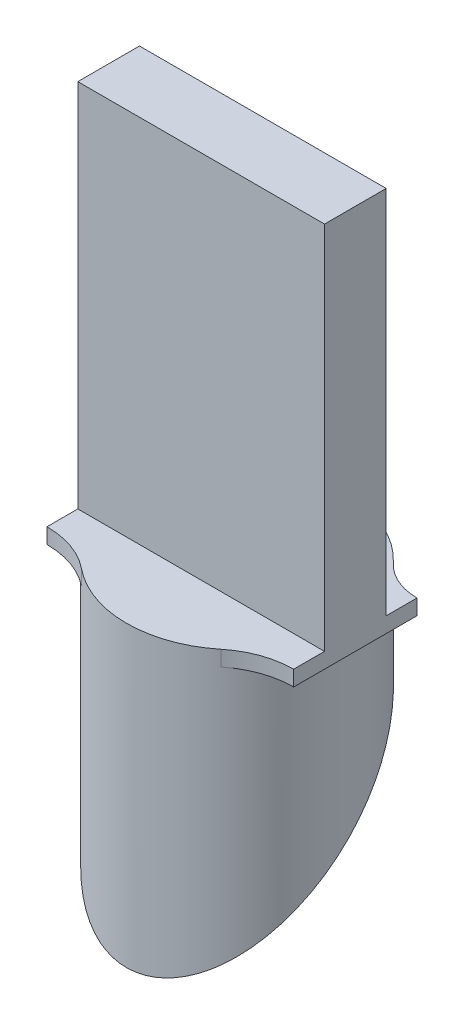
from build123d import *

# Parameters (mm, degrees)
CUT_EXTRUDE1_DEPTH      = 1054.2364613417774
CUT_EXTRUDE1_DEPTH_BACK = 1054.2364613417774
SHELL1_OUTLINE_W        = 19.594743879
SHELL1_OUTLINE_H        = 51.88948775799986
BOSS_EXTRUDE1_DEPTH     = 3.175
SKETCH5_W               = 50.79999999999999
SKETCH5_H               = 12.699999999999998
BOSS_EXTRUDE2_DEPTH     = 76.2


# Read off the part's stored shape, not the designer's step: Shell1
with BuildPart() as part:
    # Sketch2 → Revolve1 (revolve)
    with BuildSketch(Plane(origin=(0, 0, 0), x_dir=(0, 0, -1), z_dir=(1, 0, 0))):
        Polygon((1.0414000000000794, 1052.7210512242139), (-21.7283438789312, 1052.7210512242139), (-21.7283438789312, 994.4815634663521), (1.0414000000000847, 994.4815634663521), align=None)
    revolve(axis=Axis((0, 1052.7210512242139, -1.0414000000000794), (0, -1, -9e-17)))

    # Sketch3 → Cut-Extrude1 (cut, two sides: drawn at the far end of the back side and taken through both)
    with BuildSketch(Plane(origin=(0, 0, 0), x_dir=(0, 0, -1), z_dir=(1, 0, 0)).offset(-CUT_EXTRUDE1_DEPTH_BACK)):
        Polygon((-21.7283438789312, 994.4815634663521), (23.811143878931354, 1040.0210512242138), (23.811143878931365, 994.4815634663521), align=None)
    extrude(amount=CUT_EXTRUDE1_DEPTH + CUT_EXTRUDE1_DEPTH_BACK, mode=Mode.SUBTRACT)

    # Shell1 outline → Shell1 (revolve, cut)
    with BuildSketch(Plane.XY.offset(-1.0414)):
        with Locations((9.7973719395, 1023.601307345)):
            Rectangle(SHELL1_OUTLINE_W, SHELL1_OUTLINE_H)
    revolve(axis=Axis((0, 0, -1.0414), (0, 1, 0)), mode=Mode.SUBTRACT)

    # Sketch4 → Boss-Extrude1 (add)
    with BuildSketch(Plane(origin=(0, 1052.7210512242139, 9.407e-14), x_dir=(1, 0, 0), z_dir=(0, 1, 0))):
        with BuildLine():
            Line((25.4, 12.700000000000092), (25.4, -12.699999999999907))
            ThreePointArc((25.4, -12.699999999999907), (19.547591344304465, -13.709181649641387), (14.371169963720073, -16.62016024211882))
            ThreePointArc((14.371169963720073, -16.62016024211882), (-8.72e-15, -21.72834387893111), (-14.371169963720085, -16.620160242118818))
            ThreePointArc((-14.371169963720085, -16.620160242118818), (-19.54759134430447, -13.709181649641383), (-25.4, -12.699999999999907))
            Line((-25.4, -12.699999999999907), (-25.4, 12.700000000000092))
            ThreePointArc((-25.4, 12.700000000000092), (-20.663631299775105, 13.690635523953107), (-16.72131200571086, 16.496462637200914))
            ThreePointArc((-16.72131200571086, 16.496462637200914), (1.39e-15, 23.811143878931446), (16.72131200571086, 16.496462637200906))
            ThreePointArc((16.72131200571086, 16.496462637200906), (20.663631299775105, 13.690635523953098), (25.4, 12.700000000000092))
        make_face()
    extrude(amount=BOSS_EXTRUDE1_DEPTH)

    # Sketch5 → Boss-Extrude2 (add)
    with BuildSketch(Plane(origin=(0, 1055.8960512242138, 0), x_dir=(1, 0, 0), z_dir=(0, 1, 0))):
        Rectangle(SKETCH5_W, SKETCH5_H)
    extrude(amount=BOSS_EXTRUDE2_DEPTH)


solid = part.part
